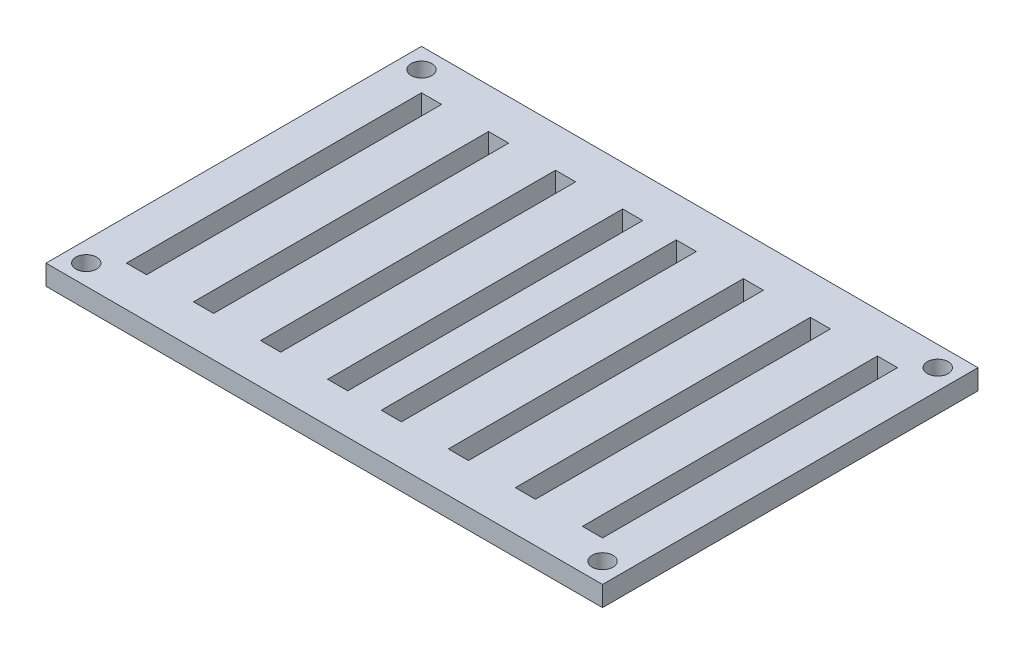
from build123d import *

# Parameters (mm, degrees)
SKETCH_1_W          = 83
SKETCH_1_H          = 56
SKETCH_1_R          = 1.55
EXTRUDE_1_DEPTH     = 3
SKETCH_3_W          = 3
SKETCH_3_H          = 44
CUT_EXTRUDE_1_DEPTH = 51.152268144


with BuildPart() as part:
    # ｽｹｯﾁ1 → ﾎﾞｽ - 押し出し1 (new body)
    with BuildSketch(Plane(origin=(0, 0, 0), x_dir=(1, 0, 0), z_dir=(0, 1, 0))):
        Rectangle(SKETCH_1_W, SKETCH_1_H)
        with Locations((-38.5, 25)):
            Circle(SKETCH_1_R, mode=Mode.SUBTRACT)
        with Locations((38.5, 25)):
            Circle(SKETCH_1_R, mode=Mode.SUBTRACT)
        with Locations((38.5, -25)):
            Circle(SKETCH_1_R, mode=Mode.SUBTRACT)
        with Locations((-38.5, -25)):
            Circle(SKETCH_1_R, mode=Mode.SUBTRACT)
    extrude(amount=EXTRUDE_1_DEPTH)

    # ｽｹｯﾁ3 → ｶｯﾄ - 押し出し1 (cut, through all)
    with BuildSketch(Plane(origin=(0, 3, 0), x_dir=(1, 0, 0), z_dir=(0, 1, 0))):
        with Locations((-34, 0)):
            Rectangle(SKETCH_3_W, SKETCH_3_H)
        with Locations((-24, 0)):
            Rectangle(SKETCH_3_W, SKETCH_3_H)
        with Locations((-14, 0)):
            Rectangle(SKETCH_3_W, SKETCH_3_H)
        with Locations((-4, 0)):
            Rectangle(SKETCH_3_W, SKETCH_3_H)
        with Locations((4, 0)):
            Rectangle(SKETCH_3_W, SKETCH_3_H)
        with Locations((14, 0)):
            Rectangle(SKETCH_3_W, SKETCH_3_H)
        with Locations((24, 0)):
            Rectangle(SKETCH_3_W, SKETCH_3_H)
        with Locations((34, 0)):
            Rectangle(SKETCH_3_W, SKETCH_3_H)
    extrude(amount=-CUT_EXTRUDE_1_DEPTH, mode=Mode.SUBTRACT)


solid = part.part
